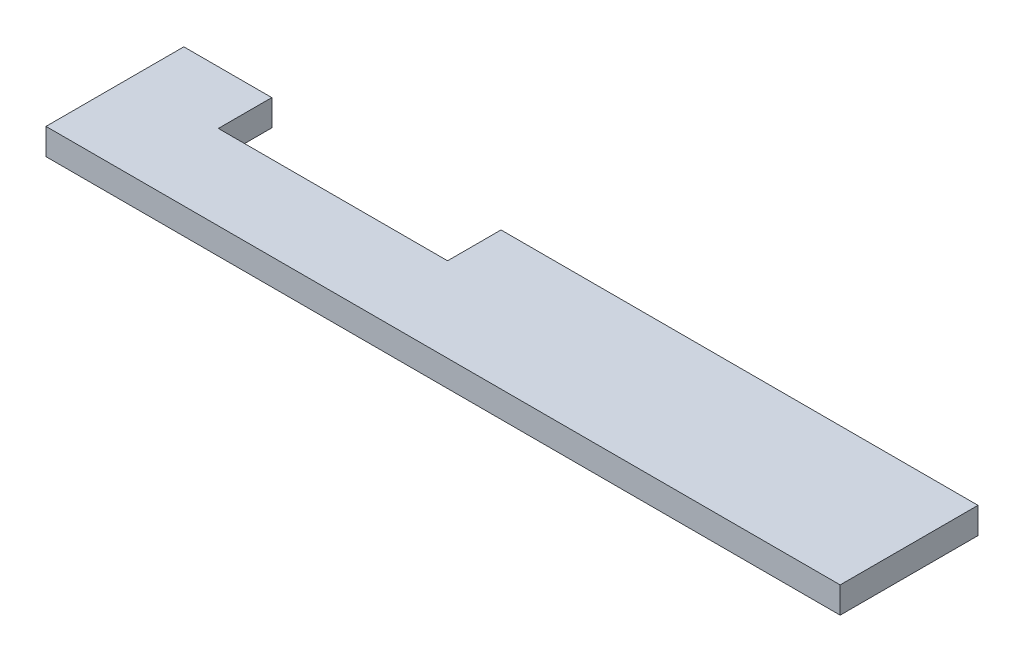
from build123d import *

# Parameters (mm, degrees)
SKETCH1_W               = 121
SKETCH1_H               = 21
BOSS_EXTRUDE1_DEPTH     = 4
CUT_EXTRUDE1_DEPTH      = 62.534543144
CUT_EXTRUDE1_DEPTH_BACK = 62.534543144
SKETCH2_W               = 34.925465689
SKETCH2_H               = 8.142757597


with BuildPart() as part:
    # Sketch1 → Boss-Extrude1 (new body)
    with BuildSketch(Plane(origin=(0, 0, 0), x_dir=(1, 0, 0), z_dir=(0, 1, 0))):
        Rectangle(SKETCH1_W, SKETCH1_H)
    extrude(amount=BOSS_EXTRUDE1_DEPTH)

    # Sketch2 → Cut-Extrude1 (cut, two sides: drawn at the far end of the back side and taken through both)
    with BuildSketch(Plane(origin=(0, 0, 0), x_dir=(1, 0, 0), z_dir=(0, 1, 0)).offset(-CUT_EXTRUDE1_DEPTH_BACK)):
        with Locations((-29.6368635, 6.428621202)):
            Rectangle(SKETCH2_W, SKETCH2_H)
    extrude(amount=CUT_EXTRUDE1_DEPTH + CUT_EXTRUDE1_DEPTH_BACK, mode=Mode.SUBTRACT)


solid = part.part
